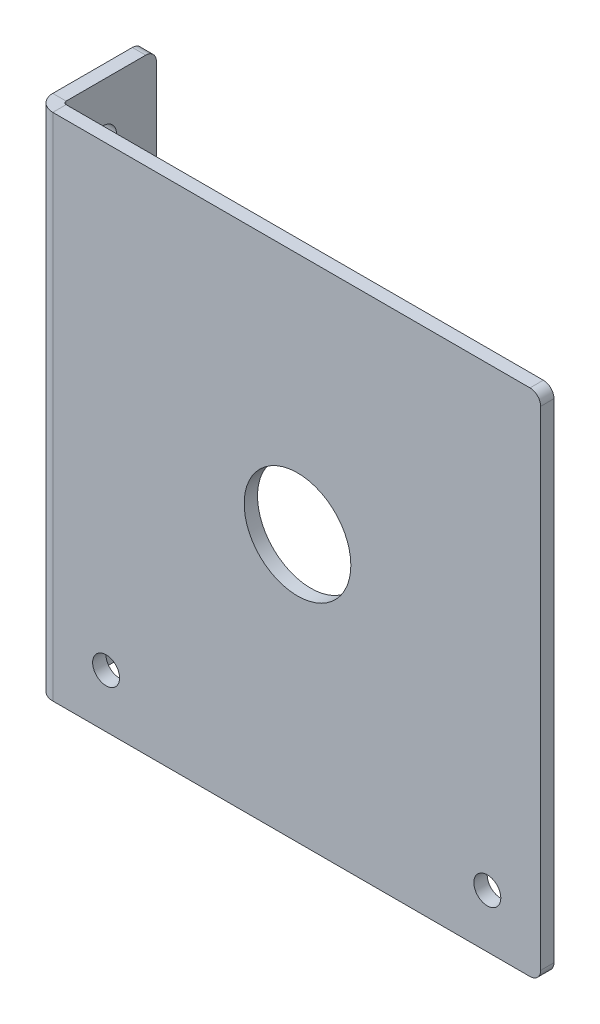
from build123d import *

# Parameters (mm, degrees)
SKETCH1_W                    = 121.4
SKETCH1_H                    = 120.087935058
SKETCH1_R                    = 12.7
BASE_FLANGE1_DEPTH           = 3.175
EDGE_FLANGE1_STRIP_W         = 14.1732
EDGE_FLANGE1_STRIP_H         = 3.175
EDGE_FLANGE1_STRIP_CUT_DEPTH = 121.4
EDGE_FLANGE1_DEPTH           = 121.4
FILLET1_R                    = 2.54
SKETCH9_R                    = 3.205
LOWER_T_SLOT_HOLES_DEPTH     = 135.888231543
SKETCH10_R                   = 3.206253706
UPPER_T_SLOT_HOLES_DEPTH     = 92.616264341


# Sheet-metal steps are written as plain solids
with BuildPart() as part:
    # Sketch1 → Base-Flange1 (new body)
    with BuildSketch(Plane(origin=(0, 0, 0), x_dir=(0, 1, 0), z_dir=(0, 0, 1))):
        with Locations((-2.8, 2.143967529)):
            Rectangle(SKETCH1_W, SKETCH1_H)
        with Locations(Location((0, 0, 0), (0, 0, 270))):
            Circle(SKETCH1_R, mode=Mode.SUBTRACT)
    extrude(amount=BASE_FLANGE1_DEPTH)

    # Edge-Flange1 strip (across the edge) → Edge-Flange1 strip cut (cut)
    with BuildSketch(Plane(origin=(-62.187935058, -63.5, 0), x_dir=(1, 0, 0), z_dir=(0, 1, 0))):
        with Locations((-3.175, -1.5875)):
            Rectangle(EDGE_FLANGE1_STRIP_W, EDGE_FLANGE1_STRIP_H)
    extrude(amount=EDGE_FLANGE1_STRIP_CUT_DEPTH, mode=Mode.SUBTRACT)

    # Edge-Flange1 section (across the edge) → Edge-Flange1 (add)
    with BuildSketch(Plane(origin=(-62.187935058, -63.5, 0), x_dir=(1, 0, 0), z_dir=(0, 1, 0))):
        with BuildLine():
            Line((0, 0.7366), (0, 22.225))
            Line((0, 22.225), (3.175, 22.225))
            Line((3.175, 22.225), (3.175, 0.7366))
            ThreePointArc((3.175, 0.7366), (3.390745145, 0.215745145), (3.9116, 0))
            Line((3.9116, 0), (3.9116, -3.175))
            ThreePointArc((3.9116, -3.175), (1.145681115, -2.029318885), (0, 0.7366))
        make_face()
    extrude(amount=EDGE_FLANGE1_DEPTH)

    # Fillet1
    fillet1_edges = [part.edges().sort_by_distance(p)[0] for p in [
        (-60.600435058, -63.5, -22.225),
        (-60.600435058, 57.9, -22.225),
        (57.9, 57.9, 1.5875),
        (57.9, -63.5, 1.5875),
    ]]
    fillet(fillet1_edges, radius=FILLET1_R)

    # Sketch9 → Lower T-Slot Holes (cut, through all)
    with BuildSketch(Plane.YZ.offset(-59.012935058)):
        with Locations(Location((45.2, -9.525, 0), (0, 0, 270))):
            Circle(SKETCH9_R)
        with Locations(Location((-25.4, -9.525, 0), (0, 0, 270))):
            Circle(SKETCH9_R)
    extrude(amount=-LOWER_T_SLOT_HOLES_DEPTH, mode=Mode.SUBTRACT)

    # Sketch10 → Upper T-Slot Holes (cut, through all)
    with BuildSketch(Plane(origin=(0, 0, 0), x_dir=(1, 0, 0), z_dir=(0, 0, -1))):
        with Locations(Location((-45.576335058, 50.8, 0), (0, 0, 180))):
            Circle(SKETCH10_R)
        with Locations(Location((45.2, 50.8, 0), (0, 0, 180))):
            Circle(SKETCH10_R)
    extrude(amount=-UPPER_T_SLOT_HOLES_DEPTH, mode=Mode.SUBTRACT)


solid = part.part
